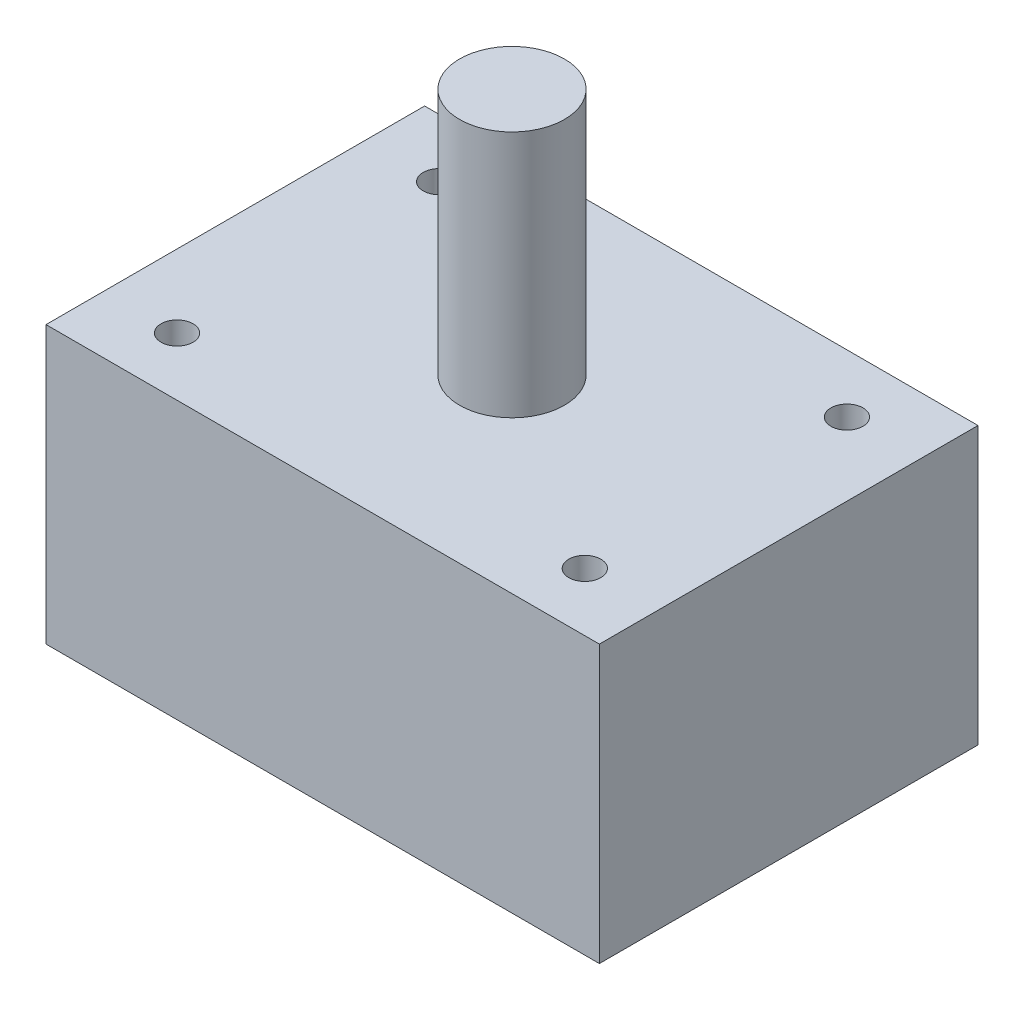
from build123d import *

# Parameters (mm, degrees)
F_01_HOUSING_PROFILE_W      = 190
F_01_HOUSING_PROFILE_H      = 130
F_01_HOUSING_PROFILE_R      = 5.5
F_01_HOUSING_BLOCK_DEPTH    = 95
F_03_OUTPUT_SHAFT_PROFILE_R = 18
F_03_OUTPUT_SHAFT_DEPTH     = 180


with BuildPart() as part:
    # 01_Housing_Profile → 01_Housing_Block (new body)
    with BuildSketch(Plane(origin=(0, 0, 0), x_dir=(1, 0, 0), z_dir=(0, 1, 0))):
        Rectangle(F_01_HOUSING_PROFILE_W, F_01_HOUSING_PROFILE_H)
        with Locations((-70, -45)):
            Circle(F_01_HOUSING_PROFILE_R, mode=Mode.SUBTRACT)
        with Locations((70, -45)):
            Circle(F_01_HOUSING_PROFILE_R, mode=Mode.SUBTRACT)
        with Locations((-70, 45)):
            Circle(F_01_HOUSING_PROFILE_R, mode=Mode.SUBTRACT)
        with Locations((70, 45)):
            Circle(F_01_HOUSING_PROFILE_R, mode=Mode.SUBTRACT)
    extrude(amount=F_01_HOUSING_BLOCK_DEPTH)

    # 03_Output_Shaft_Profile → 03_Output_Shaft (add)
    with BuildSketch(Plane(origin=(0, 0, 0), x_dir=(1, 0, 0), z_dir=(0, 1, 0))):
        Circle(F_03_OUTPUT_SHAFT_PROFILE_R)
    extrude(amount=F_03_OUTPUT_SHAFT_DEPTH)


solid = part.part
